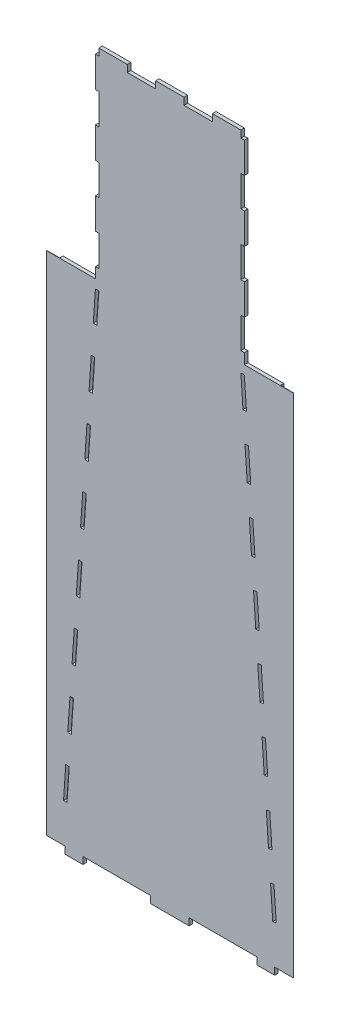
from build123d import *

# Parameters (mm, degrees)
BOSS_EXTRUDE1_DEPTH = 10.16
SKETCH2_W           = 38.1
SKETCH2_H           = 9.5
CUT_EXTRUDE1_DEPTH  = 2540


with BuildPart() as part:
    # Sketch1 → Boss-Extrude1 (new body)
    with BuildSketch(Plane.XY):
        Polygon((-123.444, 2072.64), (-205.715298803, 2072.64), (-205.715298803, 2052.32), (-215.881789204, 2052.32), (-215.881789204, 1963.42), (-205.715298803, 1963.42), (-205.715298803, 1874.52), (-215.881789204, 1874.52), (-215.881789204, 1785.62), (-205.715298803, 1785.62), (-205.715298803, 1696.72), (-215.875298803, 1696.72), (-215.875298803, 1607.82), (-205.715298803, 1607.82), (-205.715298803, 1518.92), (-215.881789204, 1518.92), (-215.881789204, 1488.440000035), (-358.121789204, 1488.440000035), (-358.121789204, 20.32), (-303.52, 20.32), (-303.52, 0), (-252, 0), (-252, 20.32), (-55.8292, 20.32), (-55.8292, 0), (55.8292, 0), (55.8292, 20.32), (252, 20.32), (252, 0), (303.52, 0), (303.52, 20.32), (358.121789204, 20.32), (358.121789204, 1488.440000035), (215.881789204, 1488.440000035), (215.881789204, 1518.92), (205.715298803, 1518.92), (205.715298803, 1607.82), (215.875298803, 1607.82), (215.875298803, 1696.72), (205.715298803, 1696.72), (205.715298803, 1785.62), (215.881789204, 1785.62), (215.881789204, 1874.52), (205.715298803, 1874.52), (205.715298803, 1963.42), (215.881789204, 1963.42), (215.881789204, 2052.32), (205.715298803, 2052.32), (205.715298803, 2072.64), (123.444, 2072.64), (123.444, 2052.32), (41.135649402, 2052.32), (41.135649402, 2072.64), (-41.135649402, 2072.64), (-41.135649402, 2052.32), (-123.444, 2052.32), align=None)
        Polygon((227.836927701, 1290.916856945), (234.358656272, 1197.020795404), (224.240976188, 1196.318052795), (217.719247617, 1290.214114336), align=None, mode=Mode.SUBTRACT)
        Polygon((211.92306481, 1373.664189215), (205.715298803, 1463.040000035), (215.881789204, 1463.040000035), (222.040744894, 1374.366931824), align=None, mode=Mode.SUBTRACT)
        Polygon((-222.040744894, 1374.366931824), (-215.881789204, 1463.040000035), (-205.715298803, 1463.040000035), (-211.92306481, 1373.664189215), align=None, mode=Mode.SUBTRACT)
        Polygon((-308.266124544, 132.94397688), (-301.755453134, 226.680843836), (-291.63777305, 225.978101227), (-298.14844446, 132.241234271), align=None, mode=Mode.SUBTRACT)
        Polygon((-289.435698895, 404.053512688), (-279.318018811, 403.350770078), (-285.830533081, 309.587370692), (-295.948213166, 310.290113301), align=None, mode=Mode.SUBTRACT)
        Polygon((-283.630301787, 487.636249721), (-277.115944656, 581.426181539), (-266.998264572, 580.72343893), (-273.512621703, 486.933507112), align=None, mode=Mode.SUBTRACT)
        Polygon((-264.796190418, 758.798850391), (-254.678510334, 758.096107781), (-261.194710324, 664.279643533), (-271.312390408, 664.982386142), align=None, mode=Mode.SUBTRACT)
        Polygon((-252.476436179, 936.171519242), (-242.358756095, 935.468776633), (-248.876798945, 841.625779953), (-258.99447903, 842.328522563), align=None, mode=Mode.SUBTRACT)
        Polygon((301.755453134, 226.680843836), (308.266124544, 132.94397688), (298.14844446, 132.241234271), (291.63777305, 225.978101227), align=None, mode=Mode.SUBTRACT)
        Polygon((279.318018811, 403.350770078), (289.435698895, 404.053512688), (295.948213166, 310.290113301), (285.830533081, 309.587370692), align=None, mode=Mode.SUBTRACT)
        Polygon((254.678510334, 758.096107781), (264.796190418, 758.798850391), (271.312390408, 664.982386142), (261.194710324, 664.279643533), align=None, mode=Mode.SUBTRACT)
        Polygon((277.115944656, 581.426181539), (283.630301787, 487.636249721), (273.512621703, 486.933507112), (266.998264572, 580.72343893), align=None, mode=Mode.SUBTRACT)
        Polygon((242.358756095, 935.468776633), (252.476436179, 936.171519242), (258.99447903, 842.328522563), (248.876798945, 841.625779953), align=None, mode=Mode.SUBTRACT)
        Polygon((-240.15668194, 1113.544188093), (-230.039001856, 1112.841445484), (-236.558887567, 1018.971916374), (-246.676567651, 1019.674658983), align=None, mode=Mode.SUBTRACT)
        Polygon((-227.836927701, 1290.916856945), (-217.719247617, 1290.214114336), (-224.240976188, 1196.318052795), (-234.358656272, 1197.020795404), align=None, mode=Mode.SUBTRACT)
        Polygon((230.039001856, 1112.841445484), (240.15668194, 1113.544188093), (246.676567651, 1019.674658983), (236.558887567, 1018.971916374), align=None, mode=Mode.SUBTRACT)
    extrude(amount=BOSS_EXTRUDE1_DEPTH)

    # Sketch2 → Cut-Extrude1 (cut)
    with BuildSketch(Plane(origin=(0, 0, 0), x_dir=(1, 0, 0), z_dir=(0, 1, 0))):
        with Locations((339.071789204, -4.75)):
            Rectangle(SKETCH2_W, SKETCH2_H)
        with Locations((-339.071789204, -4.75)):
            Rectangle(SKETCH2_W, SKETCH2_H)
    extrude(amount=CUT_EXTRUDE1_DEPTH, mode=Mode.SUBTRACT)


solid = part.part
